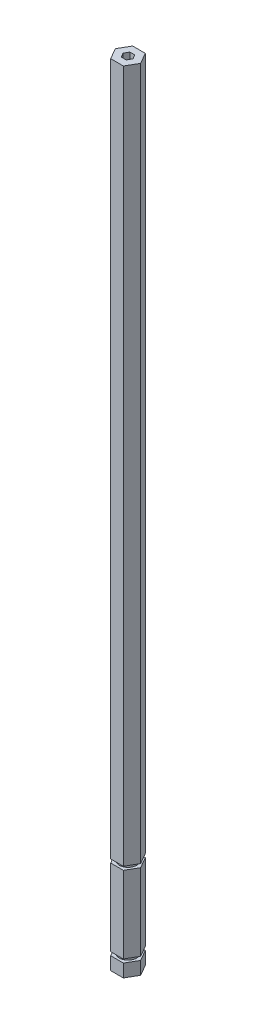
from build123d import *

# Parameters (mm, degrees)
BOSS_EXTRUDE1_DEPTH = 457.2
SKETCH3_W           = 2.54
SKETCH3_H           = 2.032


with BuildPart() as part:
    # Sketch1 → Boss-Extrude1 (new body)
    with BuildSketch(Plane(origin=(0, 0, 0), x_dir=(1, 0, 0), z_dir=(0, 1, 0))):
        Polygon((7.332348419, 0), (3.666174209, 6.35), (-3.666174209, 6.35), (-7.332348419, 0), (-3.666174209, -6.35), (3.666174209, -6.35), align=None)
        Polygon((1.443375673, 2.5), (-1.443375673, 2.5), (-2.886751346, 0), (-1.443375673, -2.5), (1.443375673, -2.5), (2.886751346, 0), align=None, mode=Mode.SUBTRACT)
    extrude(amount=BOSS_EXTRUDE1_DEPTH)

    # Sketch3 → Cut-Revolve2 (revolve, cut)
    with BuildSketch(Plane(origin=(0, 0, 0), x_dir=(0, 0, -1), z_dir=(1, 0, 0))):
        with Locations((6.2865, 54.991)):
            Rectangle(SKETCH3_W, SKETCH3_H)
        with Locations((6.2865, 8.509)):
            Rectangle(SKETCH3_W, SKETCH3_H)
    revolve(axis=Axis((0, 457.2, 0), (0, -1, 0)), mode=Mode.SUBTRACT)


solid = part.part
